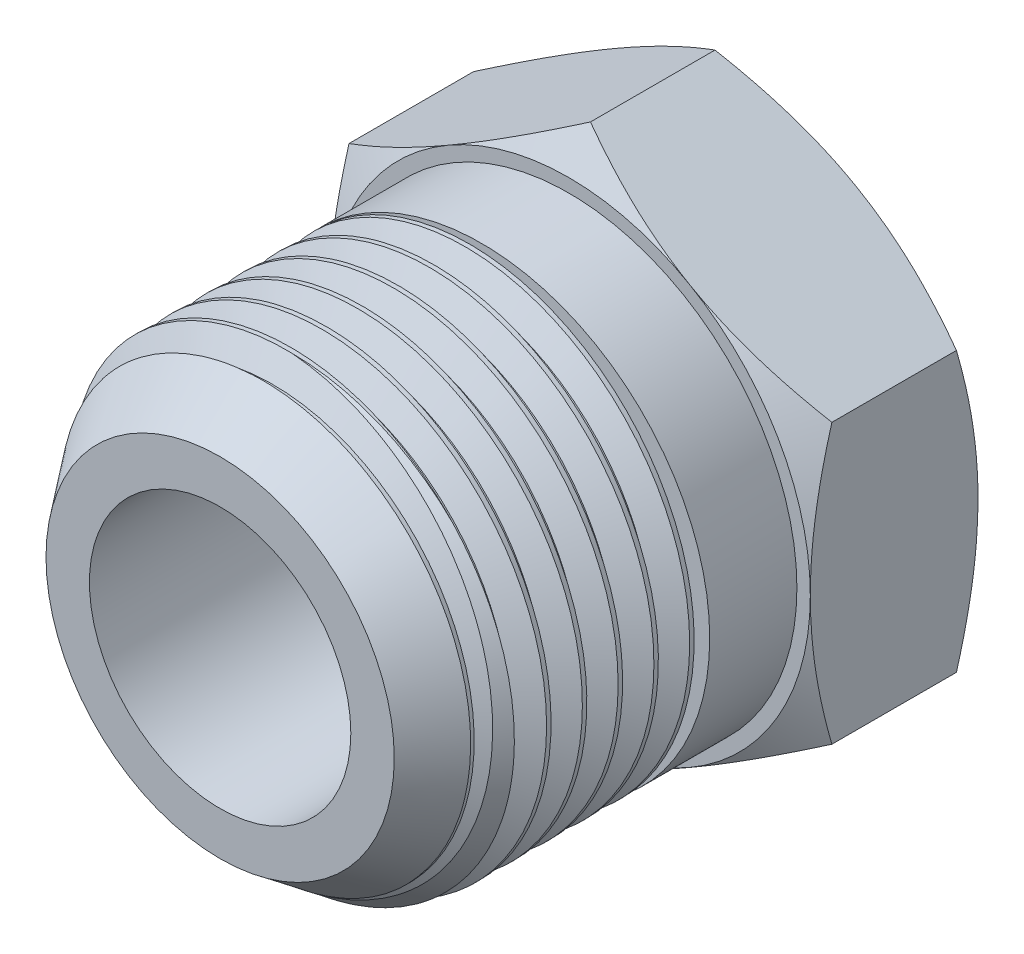
from build123d import *

# Parameters (mm, degrees)
SKETCH2_R               = 13.49375
BOSS_EXTRUDE1_DEPTH     = 15.2796875
BOSS_EXTRUDE2_DEPTH     = 9.921875
CHAMFER1_SIZE           = 4.233333333
CHAMFER1_SIZE2          = 3.190045479
SKETCH4_R               = 7.7343
CUT_EXTRUDE1_DEPTH      = 20.6375
SKETCH5_OUTSIDE_W       = 174.781
SKETCH5_OUTSIDE_H       = 179.202
SKETCH5_OUTSIDE_R       = 14.2875
CUT_EXTRUDE2_DEPTH      = 38.552429104
CUT_EXTRUDE2_DRAFT      = -60
MIRROR1_COPY_1_SKETCH_W = 174.781
MIRROR1_COPY_1_SKETCH_H = 179.202
MIRROR1_COPY_1_SKETCH_R = 14.2875
MIRROR1_COPY_1_DEPTH    = 38.552429104
MIRROR1_COPY_1_DRAFT    = -60
CUT_SWEEP1_PITCH        = 2.116666667


with BuildPart() as part:
    # Sketch2 → Boss-Extrude1 (new, symmetric)
    with BuildSketch(Plane.XY):
        Circle(SKETCH2_R)
    extrude(amount=BOSS_EXTRUDE1_DEPTH, both=True)

    # Sketch3 → Boss-Extrude2 (add)
    with BuildSketch(Plane(origin=(0, 0, -15.2796875), x_dir=(-1, 0, 0), z_dir=(0, 0, -1))):
        Polygon((14.2875, -8.248891971), (14.2875, 8.248891971), (0, 16.497783942), (-14.2875, 8.248891971), (-14.2875, -8.248891971), (0, -16.497783942), align=None)
    extrude(amount=-BOSS_EXTRUDE2_DEPTH)

    # Chamfer1
    chamfer1_edges = [part.edges().sort_by_distance(p)[0] for p in [
        (-13.49375, 0, 15.2796875),
    ]]
    chamfer1_side = [part.faces().sort_by_distance(p)[0] for p in [
        (-13.49375, 0, 4.9609375),
    ]]
    chamfer(chamfer1_edges, length=CHAMFER1_SIZE, length2=CHAMFER1_SIZE2, reference=chamfer1_side[0])

    # Sketch4 → Cut-Extrude1 (cut)
    with BuildSketch(Plane.XY.offset(15.2796875)):
        Circle(SKETCH4_R)
    extrude(amount=-CUT_EXTRUDE1_DEPTH, mode=Mode.SUBTRACT)


with BuildPart() as cut_extrude2_tool:
    # Sketch5 outside → Cut-Extrude2 (with draft: the straight prism first)
    with BuildSketch(Plane(origin=(0, 0, -15.2796875), x_dir=(-1, 0, 0), z_dir=(0, 0, -1))):
        with Locations((-0.0005, 0)):
            Rectangle(SKETCH5_OUTSIDE_W, SKETCH5_OUTSIDE_H)
        Circle(SKETCH5_OUTSIDE_R, mode=Mode.SUBTRACT)
    extrude(amount=-CUT_EXTRUDE2_DEPTH)
    # Cut-Extrude2: the draft: its side faces are tilted about the plane it starts from
    cut_extrude2_sides = [cut_extrude2_tool.faces().sort_by_distance(p)[0] for p in [
        (0.0005, -89.601, 3.996527052),
        (-87.39, 0, 3.996527052),
        (0.0005, 89.601, 3.996527052),
        (87.391, 0, 3.996527052),
        (14.2875, 0, 3.996527052),
    ]]
    draft(cut_extrude2_sides, Plane(origin=(0, 0, -15.2796875), x_dir=(-1, 0, 0), z_dir=(0, 0, -1)), CUT_EXTRUDE2_DRAFT)


with BuildPart() as part_1:
    add(part.part)

    # Cut-Extrude2: cut by cut_extrude2_tool
    add(cut_extrude2_tool.part, mode=Mode.SUBTRACT)


with BuildPart() as mirror1_copy_1_tool:
    # Mirror1 copy 1 sketch → Mirror1 copy 1 (with draft: the straight prism first)
    with BuildSketch(Plane(origin=(0, 0, -5.3578125), x_dir=(-1, 0, 0), z_dir=(0, 0, 1))):
        with Locations((-0.0005, 0)):
            Rectangle(MIRROR1_COPY_1_SKETCH_W, MIRROR1_COPY_1_SKETCH_H)
        Circle(MIRROR1_COPY_1_SKETCH_R, mode=Mode.SUBTRACT)
    extrude(amount=-MIRROR1_COPY_1_DEPTH)
    # Mirror1 copy 1: the draft: its side faces are tilted about the plane it starts from
    mirror1_copy_1_sides = [mirror1_copy_1_tool.faces().sort_by_distance(p)[0] for p in [
        (0.0005, -89.601, -24.634027052),
        (-87.39, 0, -24.634027052),
        (0.0005, 89.601, -24.634027052),
        (87.391, 0, -24.634027052),
        (14.2875, 0, -24.634027052),
    ]]
    draft(mirror1_copy_1_sides, Plane(origin=(0, 0, -5.3578125), x_dir=(-1, 0, 0), z_dir=(0, 0, 1)), MIRROR1_COPY_1_DRAFT)


with BuildPart() as part_2:
    add(part_1.part)

    # Mirror1 copy 1: cut by mirror1_copy_1_tool
    add(mirror1_copy_1_tool.part, mode=Mode.SUBTRACT)


with BuildPart() as body_2:
    # Split1: the piece on the far side of the plane
    add(part_2.part)
    split(bisect_by=Plane.XY.offset(-0.1984375), keep=Keep.BOTTOM)


with BuildPart() as part_3:
    add(part_2.part)

    # Split1
    split(bisect_by=Plane.XY.offset(-0.1984375), keep=Keep.TOP)

    # Cut-Sweep1: the profile of Sketch8 profile screwed along a left-hand helix of 8.2875 turns, 10 arcs to a turn; built about Z, then put on its axis
    cut_sweep1_z = Axis((0, 0, 0), (0, 0, 1))
    cut_sweep1_corners = [(13.49405, 0, -1.852256538), (13.49405, 0, 0.000173205), (12.118934671, 0, -0.79375), (12.118934671, 0, -1.058333333)]
    with BuildLine(mode=Mode.PRIVATE) as cut_sweep1_profile:
        Line(cut_sweep1_corners[0], cut_sweep1_corners[1])
        Line(cut_sweep1_corners[1], cut_sweep1_corners[2])
        Line(cut_sweep1_corners[2], cut_sweep1_corners[3])
        Line(cut_sweep1_corners[3], cut_sweep1_corners[0])
    cut_sweep1_cap = Face(cut_sweep1_profile.wire())
    cut_sweep1_turn_angles = [0, -18, -36, -54, -72, -90, -108, -126, -144, -162, -180, -198, -216, -234, -252, -270, -288, -306, -324, -342, -360]
    cut_sweep1_turn_weights = [1, 0.9510565162951535, 1, 0.9510565162951535, 1, 0.9510565162951535, 1, 0.9510565162951535, 1, 0.9510565162951535, 1, 0.9510565162951535, 1, 0.9510565162951535, 1, 0.9510565162951535, 1, 0.9510565162951535, 1, 0.9510565162951535, 1]
    cut_sweep1_turn_rails = [Edge.make_bspline([Vector(p[0], p[1], 0).rotate(cut_sweep1_z, cut_sweep1_turn_angles[k]) / cut_sweep1_turn_weights[k] + Vector(0, 0, p[2] + -CUT_SWEEP1_PITCH * cut_sweep1_turn_angles[k] / 360) for k in range(21)], [0, 0, 0, 1, 1, 2, 2, 3, 3, 4, 4, 5, 5, 6, 6, 7, 7, 8, 8, 9, 9, 10, 10, 10], 2, cut_sweep1_turn_weights) for p in cut_sweep1_corners]
    cut_sweep1_turn_sides = [Face.make_surface_from_curves(cut_sweep1_turn_rails[p[0]], cut_sweep1_turn_rails[p[1]]) for p in [(0, 1), (1, 2), (2, 3), (3, 0)]]
    cut_sweep1_turn = Solid(Shell([*cut_sweep1_turn_sides, cut_sweep1_cap, cut_sweep1_cap.rotate(cut_sweep1_z, -360).moved(Location((0, 0, -CUT_SWEEP1_PITCH * -360 / 360)))]))
    cut_sweep1_last_angles = [-2880, -2898, -2916, -2934, -2952, -2967.75, -2983.5]
    cut_sweep1_last_weights = [1, 0.9510565162951535, 1, 0.9510565162951535, 1, 0.9624552364536204, 1]
    cut_sweep1_last_rails = [Edge.make_bspline([Vector(p[0], p[1], 0).rotate(cut_sweep1_z, cut_sweep1_last_angles[k]) / cut_sweep1_last_weights[k] + Vector(0, 0, p[2] + -CUT_SWEEP1_PITCH * cut_sweep1_last_angles[k] / 360) for k in range(7)], [0, 0, 0, 1, 1, 2, 2, 3, 3, 3], 2, cut_sweep1_last_weights) for p in cut_sweep1_corners]
    cut_sweep1_last_sides = [Face.make_surface_from_curves(cut_sweep1_last_rails[p[0]], cut_sweep1_last_rails[p[1]]) for p in [(0, 1), (1, 2), (2, 3), (3, 0)]]
    cut_sweep1_last = Solid(Shell([*cut_sweep1_last_sides, cut_sweep1_cap.rotate(cut_sweep1_z, -2880).moved(Location((0, 0, -CUT_SWEEP1_PITCH * -2880 / 360))), cut_sweep1_cap.rotate(cut_sweep1_z, -2983.5).moved(Location((0, 0, -CUT_SWEEP1_PITCH * -2983.5 / 360)))]))
    cut_sweep1_each = [*[cut_sweep1_turn.moved(Location((0, 0, CUT_SWEEP1_PITCH * i))) for i in range(8)], cut_sweep1_last]
    add(Plane(origin=(0, 0, 15.2796875), x_dir=(0, 1, 0), z_dir=(0, 0, -1)) * Compound([cut_sweep1_each[i] for i in range(0, 9, 2)]), mode=Mode.SUBTRACT)
    add(Plane(origin=(0, 0, 15.2796875), x_dir=(0, 1, 0), z_dir=(0, 0, -1)) * Compound([cut_sweep1_each[i] for i in range(1, 9, 2)]), mode=Mode.SUBTRACT)


with BuildPart() as body_2_1:
    add(body_2.part)

    # Combine2: union part
    add(part_3.part)


solid = body_2_1.part
